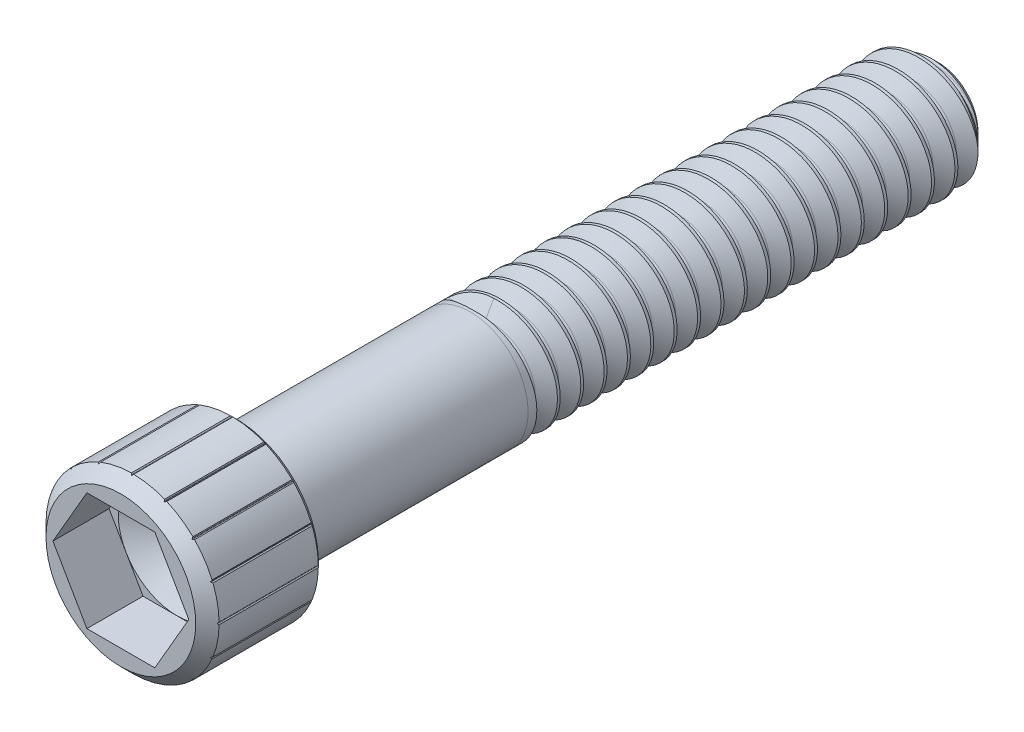
from build123d import *

# Parameters (mm, degrees)
CUT_EXTRUDE1_DEPTH = 3.048
CUT_SWEEP1_PITCH   = 1.27
CUT_EXTRUDE2_DEPTH = 45.86864537
CUT_EXTRUDE3_REACH = 46.869
CIRPATTERN1_COUNT  = 16


with BuildPart() as part:
    # Sketch1 → Revolve1 (revolve)
    with BuildSketch(Plane(origin=(0, 0, 0), x_dir=(0, 0, -1), z_dir=(1, 0, 0)), mode=Mode.PRIVATE) as revolve1_sk:
        with BuildLine():
            Line((4.892085627, 0), (44.3738, 0))
            Line((44.3738, 0), (44.3738, 2.159))
            Line((44.3738, 2.159), (43.409235, 3.123565))
            Line((43.409235, 3.123565), (25.3238, 3.123565))
            Line((25.3238, 3.123565), (18.9738, 3.133725))
            Line((18.9738, 3.133725), (6.4516, 3.133725))
            ThreePointArc((6.4516, 3.133725), (6.325876414, 3.185801414), (6.2738, 3.311525))
            Line((6.2738, 3.311525), (6.2738, 4.445))
            Line((6.2738, 4.445), (6.0198, 4.699))
            Line((6.0198, 4.699), (0.635, 4.699))
            Line((0.635, 4.699), (0, 4.064))
            Line((0, 4.064), (0, 3.19405))
            Line((0, 3.19405), (3.048, 3.19405))
            Line((3.048, 3.19405), (4.892085627, 0))
        make_face()
    revolve(revolve1_sk.sketch.rotate(Axis((0, 0, -4.892085627), (0, 0, -1)), 180), axis=Axis((0, 0, -4.892085627), (0, 0, -1)))

    # Sketch2 → Cut-Extrude1 (cut)
    with BuildSketch(Plane.XY):
        Polygon((-1.844085627, 3.19405), (1.844085627, 3.19405), (3.688171255, 0), (1.844085627, -3.19405), (-1.844085627, -3.19405), (-3.688171255, 0), align=None)
    extrude(amount=-CUT_EXTRUDE1_DEPTH, mode=Mode.SUBTRACT)

    # Cut-Sweep1: arcs per turn and ends read off the stored shape
    # Cut-Sweep1: the profile of Sketch4 screwed along a right-hand helix through 20 turns, 8 arcs to a turn; built about Z, then put on its axis
    cut_sweep1_z = Axis((0, 0, 0), (0, 0, 1))
    cut_sweep1_corners = [(3.159433065, 0, -0.138040686), (2.366934216, 0, -0.595590387), (2.298354248, 0, -0.714374449), (2.366934279, 0, -0.833158476), (3.159433065, 0, -1.290707586)]
    with BuildLine(mode=Mode.PRIVATE) as cut_sweep1_profile:
        Line(cut_sweep1_corners[0], cut_sweep1_corners[1])
        Line(cut_sweep1_corners[3], cut_sweep1_corners[4])
        Line(cut_sweep1_corners[4], cut_sweep1_corners[0])
        ThreePointArc((2.366934216, 0, -0.595590387), (2.316730185, 0, -0.645794445), (2.298354248, 0, -0.714374449))
        ThreePointArc((2.298354248, 0, -0.714374449), (2.316730221, 0, -0.782954445), (2.366934279, 0, -0.833158476))
    cut_sweep1_cap = Face(cut_sweep1_profile.wire())
    cut_sweep1_arcs = [((2.366934216, 0, -0.595590387), (2.298354227, 0, -0.635185087), (2.298354248, 0, -0.714374449), (1, 0.8660254037844467, 1)), ((2.298354248, 0, -0.714374449), (2.298354268, 0, -0.793563812), (2.366934279, 0, -0.833158476), (1, 0.8660254037844467, 1))]  # start, shoulder, end, weights
    cut_sweep1_turn_angles = [0, 22.5, 45, 67.5, 90, 112.5, 135, 157.5, 180, 202.5, 225, 247.5, 270, 292.5, 315, 337.5, 360]
    cut_sweep1_turn_weights = [1, 0.9238795325112867, 1, 0.9238795325112867, 1, 0.9238795325112867, 1, 0.9238795325112867, 1, 0.9238795325112867, 1, 0.9238795325112867, 1, 0.9238795325112867, 1, 0.9238795325112867, 1]
    cut_sweep1_turn_rails = [Edge.make_bspline([Vector(p[0], p[1], 0).rotate(cut_sweep1_z, cut_sweep1_turn_angles[k]) / cut_sweep1_turn_weights[k] + Vector(0, 0, p[2] + CUT_SWEEP1_PITCH * cut_sweep1_turn_angles[k] / 360) for k in range(17)], [0, 0, 0, 1, 1, 2, 2, 3, 3, 4, 4, 5, 5, 6, 6, 7, 7, 8, 8, 8], 2, cut_sweep1_turn_weights) for p in cut_sweep1_corners]
    cut_sweep1_turn_sides = [*[Face.make_surface_from_curves(cut_sweep1_turn_rails[p[0]], cut_sweep1_turn_rails[p[1]]) for p in [(0, 1), (3, 4), (4, 0)]], *[Face.make_bezier_surface([[Vector(p[j][0], p[j][1], 0).rotate(cut_sweep1_z, cut_sweep1_turn_angles[2 * i + k]) / cut_sweep1_turn_weights[2 * i + k] + Vector(0, 0, p[j][2] + CUT_SWEEP1_PITCH * cut_sweep1_turn_angles[2 * i + k] / 360) for k in range(3)] for j in range(3)], [[p[3][j] * cut_sweep1_turn_weights[2 * i + k] for k in range(3)] for j in range(3)]) for p in cut_sweep1_arcs for i in range(8)]]
    cut_sweep1 = Plane(origin=(0, 0, -44.3738), x_dir=(0, 1, 0), z_dir=(0, 0, 1)) * Solid(Shell([*[p.moved(Location((0, 0, CUT_SWEEP1_PITCH * i))) for i in range(20) for p in cut_sweep1_turn_sides], cut_sweep1_cap, cut_sweep1_cap.rotate(cut_sweep1_z, 7200).moved(Location((0, 0, CUT_SWEEP1_PITCH * 7200 / 360)))]))
    add(cut_sweep1, mode=Mode.SUBTRACT)

    # Sketch5 → Cut-Extrude2 (cut, through all)
    with BuildSketch(Plane(origin=(0, 0, 0), x_dir=(0, 0, -1), z_dir=(1, 0, 0))):
        with BuildLine():
            Line((19.126824611, 3.133480161), (19.569390387, 2.366934216))
            ThreePointArc((19.569390387, 2.366934216), (19.688174449, 2.298354248), (19.806958476, 2.366934279))
            Line((19.806958476, 2.366934279), (20.248487531, 3.1316855))
            Line((20.248487531, 3.1316855), (19.126824611, 3.133480161))
        make_face()
    extrude(amount=-CUT_EXTRUDE2_DEPTH, mode=Mode.SUBTRACT)

    # Cut-Extrude3: up to this cone (the profile starts inside it)
    cut_extrude3_end = Plane(origin=(0, 0, 0), z_dir=(0, 0, 1)).offset(-10.718799) * Cone(1e-06, 68.8066, 68.806599, align=(Align.CENTER, Align.CENTER, Align.MIN), mode=Mode.PRIVATE)
    # Sketch6 → Cut-Extrude3 (cut, up to the surface)
    with BuildSketch(Plane.XY, mode=Mode.PRIVATE) as cut_extrude3_sk1:
        with BuildLine():
            Line((0.017960512, 4.653460512), (0.063076629, 4.698576629))
            ThreePointArc((0.063076629, 4.698576629), (0, 4.699), (-0.063076629, 4.698576629))
            Line((-0.063076629, 4.698576629), (-0.017960512, 4.653460512))
            ThreePointArc((-0.017960512, 4.653460512), (0, 4.646021024), (0.017960512, 4.653460512))
        make_face()
    cut_extrude3_tool1 = extrude(cut_extrude3_sk1.sketch, amount=-CUT_EXTRUDE3_REACH, mode=Mode.PRIVATE) & cut_extrude3_end
    cut_extrude3 = cut_extrude3_tool1.solids().sort_by_distance((0, 4.678961, 0))[0]
    add(cut_extrude3, mode=Mode.SUBTRACT)

    # CirPattern1: Cut-Extrude3 ×16 about axis
    cirpattern1_axis = Axis((0, 0, 0), (0, 0, 1))
    for i in range(1, CIRPATTERN1_COUNT):
        add(cut_extrude3.rotate(cirpattern1_axis, i * 360 / CIRPATTERN1_COUNT), mode=Mode.SUBTRACT)


solid = part.part
